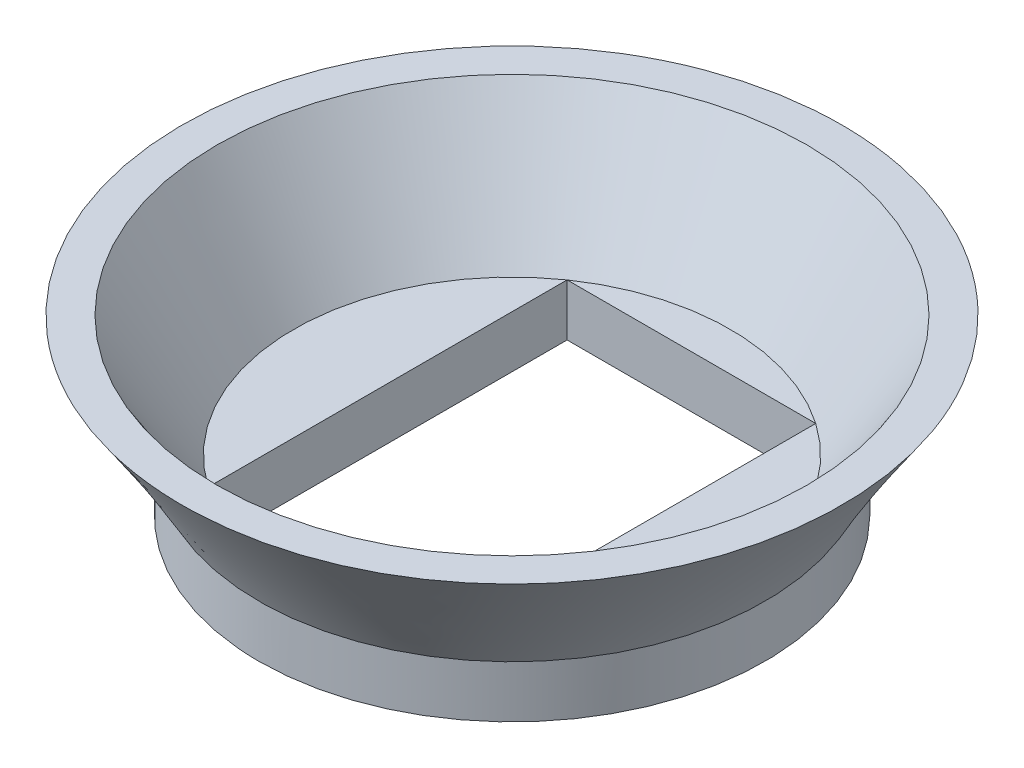
from build123d import *

# Parameters (mm, degrees)
SKETCH1_R           = 8.75
BOSS_EXTRUDE1_DEPTH = 1.8
SKETCH2_76_R        = 7.55
SKETCH3_51_R        = 10.2
SKETCH4_W           = 8.6
SKETCH4_H           = 12.41168804
CUT_EXTRUDE1_DEPTH  = 17.660132214


with BuildPart() as part:
    # Sketch1 → Boss-Extrude1 (new body)
    with BuildSketch(Plane(origin=(0, 0, 0), x_dir=(1, 0, 0), z_dir=(0, 1, 0))):
        with Locations(Location((0, 0, 0), (0, 0, 270))):
            Circle(SKETCH1_R)
    extrude(amount=BOSS_EXTRUDE1_DEPTH)

    # Loft1: read off the stored shape, not the designer's step
    # Loft1: loft between two sections, ruled curve by curve
    loft1_from = [
        Edge.make_bspline([(-0.757744305, 1.8, 8.717128172), (16.67651204, 1.8, 10.232616781), (18.192000649, 1.8, -7.201639563), (0.757744305, 1.8, -8.717128172), (-16.67651204, 1.8, -10.232616781), (-18.192000649, 1.8, 7.201639563), (-0.757744305, 1.8, 8.717128172)], [0, 0, 0, 0, 0.5, 0.5, 0.5, 1, 1, 1, 1], 3, [1, 0.333333333, 0.333333333, 1, 0.333333333, 0.333333333, 1]),
    ]
    loft1_to = [
        Edge.make_bspline([(-3.814399501, 6, 10.742921225), (17.671442948, 6, 18.371720228), (25.300241951, 6, -3.114122222), (3.814399501, 6, -10.742921225), (-17.671442948, 6, -18.371720228), (-25.300241951, 6, 3.114122222), (-3.814399501, 6, 10.742921225)], [0, 0, 0, 0, 0.5, 0.5, 0.5, 1, 1, 1, 1], 3, [1, 0.333333333, 0.333333333, 1, 0.333333333, 0.333333333, 1]),
    ]
    loft1 = Solid(Shell([*[Face.make_surface_from_curves(loft1_from[k], loft1_to[k]) for k in range(1)], Face(Wire(loft1_from)), Face(Wire(loft1_to))]))
    add(loft1)

    # Sketch2<76> → Cut-Loft1 section 0
    with BuildSketch(Plane(origin=(0, 1.8, 0), x_dir=(1, 0, 0), z_dir=(0, 1, 0))):
        Circle(SKETCH2_76_R)
    # Sketch3<51> → Cut-Loft1 section 1
    with BuildSketch(Plane(origin=(0, 6, 0), x_dir=(1, 0, 0), z_dir=(0, 1, 0))):
        Circle(SKETCH3_51_R)
    loft(mode=Mode.SUBTRACT)

    # Sketch4 → Cut-Extrude1 (cut, through all)
    with BuildSketch(Plane(origin=(0, 1.8, 0), x_dir=(1, 0, 0), z_dir=(0, 1, 0))):
        Rectangle(SKETCH4_W, SKETCH4_H)
    extrude(amount=-CUT_EXTRUDE1_DEPTH, mode=Mode.SUBTRACT)


solid = part.part
